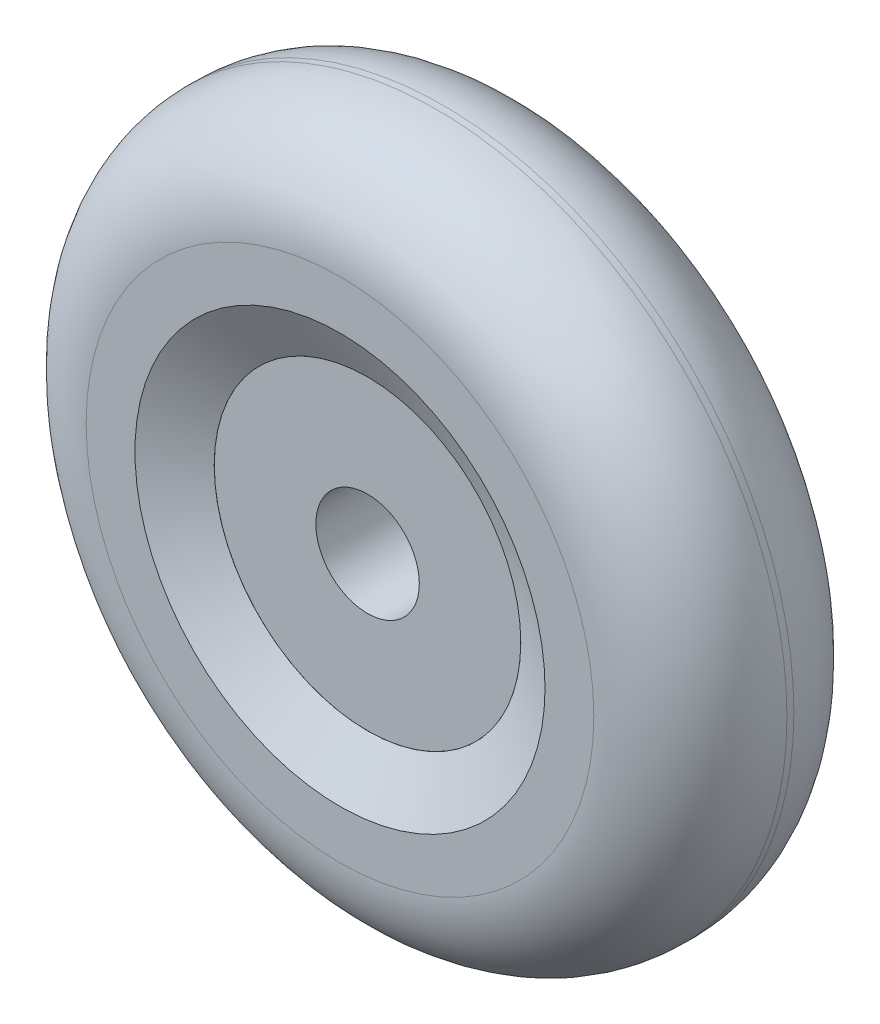
from build123d import *
from build123d.topology import SkipClean

# Parameters (mm, degrees)
CROQUIS1_R                   = 101.6
CROQUIS1_R_2                 = 7.9375
SALIENTE_EXTRUIR1_DEPTH      = 29
REDONDEO1_R                  = 28
CROQUIS2_R                   = 44.45
CORTAR_EXTRUIR1_DEPTH        = 8
CHAFL_N1_SIZE                = 15
CHAFL_N1_SIZE2               = 7.975641475
CHAFL_N2_SIZE                = 7.975641475
CHAFL_N2_SIZE_2              = 15
CORTAR_EXTRUIR2_DEPTH        = 147.581445076
CORTAR_EXTRUIR2_DEPTH_BACK   = 147.581445076
CROQUIS5_R                   = 7.9375
SALIENTE_EXTRUIR2_DEPTH      = 120
CROQUIS6_R                   = 12.9375
CROQUIS6_R_2                 = 7.9375
SALIENTE_EXTRUIR3_DEPTH      = 20
CROQUIS8_R                   = 3
CORTAR_EXTRUIR3_DEPTH        = 20
SALIENTE_EXTRUIR4_DEPTH      = 10
REDONDEO2_R                  = 1
CROQUIS11_R                  = 15
CORTAR_EXTRUIR4_DEPTH        = 50
SALIENTE_EXTRUIR5_DEPTH      = 5
SALIENTE_EXTRUIR5_DEPTH_BACK = 50
CROQUIS12_R                  = 15
CROQUIS12_R_2                = 7.9375
CROQUIS15_R                  = 7.9375
SALIENTE_EXTRUIR7_DEPTH      = 5
CROQUIS13_R                  = 3
SALIENTE_EXTRUIR8_DEPTH      = 5
SALIENTE_EXTRUIR8_2_DEPTH    = 5
SALIENTE_EXTRUIR8_3_DEPTH    = 5
SALIENTE_EXTRUIR8_4_DEPTH    = 5
CROQUIS17_R                  = 3
CORTAR_EXTRUIR5_DEPTH        = 16


with BuildPart() as part:
    # Croquis1 → Saliente-Extruir1 (new, symmetric)
    with BuildSketch(Plane.XY):
        with Locations(Location((0, 0, 0), (0, 0, 180))):
            Circle(CROQUIS1_R)
        with Locations(Location((0, 0, 0), (0, 0, 180))):
            Circle(CROQUIS1_R_2, mode=Mode.SUBTRACT)
    extrude(amount=SALIENTE_EXTRUIR1_DEPTH, both=True)

    # Redondeo1
    redondeo1_edges = [part.edges().sort_by_distance(p)[0] for p in [
        (101.6, 0, -29),
        (101.6, 0, 29),
    ]]
    fillet(redondeo1_edges, radius=REDONDEO1_R)

    # Croquis2 → Cortar-Extruir1 (cut)
    with BuildSketch(Plane(origin=(0, 0, -29), x_dir=(-1, 0, 0), z_dir=(0, 0, -1))):
        Circle(CROQUIS2_R)
    cortar_extruir1 = extrude(amount=-CORTAR_EXTRUIR1_DEPTH, mode=Mode.SUBTRACT)

    # Simetría3: Cortar-Extruir1 across plane
    add(cortar_extruir1.mirror(Plane.XY), mode=Mode.SUBTRACT)

    # Chaflán1
    chafl_n1_edges = [part.edges().sort_by_distance(p)[0] for p in [
        (44.45, 0, -29),
    ]]
    chafl_n1_side = [part.faces().sort_by_distance(p)[0] for p in [
        (71.518277636, 0, -29),
    ]]
    chamfer(chafl_n1_edges, length=CHAFL_N1_SIZE, length2=CHAFL_N1_SIZE2, reference=chafl_n1_side[0])

    # Chaflán2
    # the kernel refuses this chamfer: 15, 7.975641475 mm, written as the material it takes off along each edge
    with BuildSketch(Plane(origin=(0, 0, 29), x_dir=(-1, 0, 0), z_dir=(0, -1, 0))) as chafl_n2_piece_1_section:
        Polygon((44.45 + CHAFL_N2_SIZE, 0), (44.45, CHAFL_N2_SIZE_2), (44.45, 0), align=None)
    chafl_n2_piece_1 = revolve(axis=Axis((0, 0, 29), (0, 0, -1)), mode=Mode.PRIVATE)
    chafl_n2_piece_1 = split(chafl_n2_piece_1, bisect_by=Plane(origin=(50.219175815, 0, 21), z_dir=(0, 0, 1)), keep=Keep.TOP, mode=Mode.PRIVATE)
    add(chafl_n2_piece_1, mode=Mode.SUBTRACT)

    # Croquis3 → Cortar-Extruir2 (cut, two sides: drawn at the far end of the back side and taken through both)
    with BuildSketch(Plane(origin=(0, 0, 0), x_dir=(0, 0, -1), z_dir=(1, 0, 0)).offset(-CORTAR_EXTRUIR2_DEPTH_BACK)):
        Polygon((0, -580.951086966), (0, -121.331484358), (0, 121.331484358), (0, 580.951086966), (-919.239205217, 580.951086966), (-919.239205217, -580.951086966), align=None)
    extrude(amount=CORTAR_EXTRUIR2_DEPTH + CORTAR_EXTRUIR2_DEPTH_BACK, mode=Mode.SUBTRACT)

    # Simetría4: part across plane


with BuildPart() as part_1:
    add(part.part)
    add(part.part.mirror(Plane(origin=(376.375487344, -121.331484358, 0), x_dir=(1, 0, 0), z_dir=(0, 0, 1))))

    # Croquis11 → Cortar-Extruir4 (cut)
    with BuildSketch(Plane.XY.offset(21)):
        Circle(CROQUIS11_R)
    extrude(amount=-CORTAR_EXTRUIR4_DEPTH, mode=Mode.SUBTRACT)


with BuildPart() as body_2:
    # Croquis5 → Saliente-Extruir2 (new body)
    with BuildSketch(Plane.XY.offset(21)):
        with Locations(Location((0, 0, 0), (0, 0, 180))):
            Circle(CROQUIS5_R)
    extrude(amount=-SALIENTE_EXTRUIR2_DEPTH)


with BuildPart() as body_3:
    # Croquis6 → Saliente-Extruir3 (new body)
    with BuildSketch(Plane(origin=(0, 0, -99), x_dir=(-1, 0, 0), z_dir=(0, 0, -1))):
        Circle(CROQUIS6_R)
        Circle(CROQUIS6_R_2, mode=Mode.SUBTRACT)
    extrude(amount=-SALIENTE_EXTRUIR3_DEPTH)

    # Croquis8 → Cortar-Extruir3 (cut)
    with BuildSketch(Plane(origin=(0, 0, 0), x_dir=(1, 0, 0), z_dir=(0, 1, 0))):
        with Locations(Location((0, 89, 0), (0, 0, 90))):
            Circle(CROQUIS8_R)
    extrude(amount=CORTAR_EXTRUIR3_DEPTH, mode=Mode.SUBTRACT)

    # Croquis10 → Saliente-Extruir4 (add)
    with BuildSketch(Plane(origin=(0, 0, -99), x_dir=(-1, 0, 0), z_dir=(0, 0, -1))):
        with BuildLine():
            Line((-5, 17.5), (5, 17.5))
            ThreePointArc((5, 17.5), (7.856559563, 13.607960336), (12.655444566, 13.080127019))
            Line((12.655444566, 13.080127019), (17.655444566, 4.419872981))
            ThreePointArc((17.655444566, 4.419872981), (15.713119126, 0), (17.655444566, -4.419872981))
            Line((17.655444566, -4.419872981), (12.655444566, -13.080127019))
            ThreePointArc((12.655444566, -13.080127019), (7.856559563, -13.607960336), (5, -17.5))
            Line((5, -17.5), (-5, -17.5))
            ThreePointArc((-5, -17.5), (-7.856559563, -13.607960336), (-12.655444566, -13.080127019))
            Line((-12.655444566, -13.080127019), (-17.655444566, -4.419872981))
            ThreePointArc((-17.655444566, -4.419872981), (-15.713119126, 0), (-17.655444566, 4.419872981))
            Line((-17.655444566, 4.419872981), (-12.655444566, 13.080127019))
            ThreePointArc((-12.655444566, 13.080127019), (-7.856559563, 13.607960336), (-5, 17.5))
        make_face()
    extrude(amount=SALIENTE_EXTRUIR4_DEPTH)

    # Redondeo2
    redondeo2_edges = [body_3.edges().sort_by_distance(p)[0] for p in [
        (5, 17.5, -104),
        (12.655444566, 13.080127019, -104),
        (17.655444566, 4.419872981, -104),
        (17.655444566, -4.419872981, -104),
        (12.655444566, -13.080127019, -104),
        (5, -17.5, -104),
        (-5, -17.5, -104),
        (-12.655444566, -13.080127019, -104),
        (-17.655444566, -4.419872981, -104),
        (-17.655444566, 4.419872981, -104),
        (-12.655444566, 13.080127019, -104),
        (-5, 17.5, -104),
    ]]
    fillet(redondeo2_edges, radius=REDONDEO2_R)


with BuildPart() as body_4:
    # Croquis12 → Saliente-Extruir5 (new, two sides: drawn at the far end of the back side and taken through both)
    with BuildSketch(Plane.XY.offset(21).offset(-SALIENTE_EXTRUIR5_DEPTH_BACK)):
        Circle(CROQUIS12_R)
        with Locations(Location((0, 0, 0), (0, 0, 180))):
            Circle(CROQUIS12_R_2, mode=Mode.SUBTRACT)
    extrude(amount=SALIENTE_EXTRUIR5_DEPTH + SALIENTE_EXTRUIR5_DEPTH_BACK)


with BuildPart() as body_5:
    # Croquis15 → Saliente-Extruir7 (new body)
    with BuildSketch(Plane.XY.offset(21)):
        with Locations(Location((0, 0, 0), (0, 0, 180))):
            Circle(CROQUIS15_R)
    extrude(amount=SALIENTE_EXTRUIR7_DEPTH)

    # Combinar1: union body 2
    add(body_2.part)


with BuildPart() as body_5_2:
    # Croquis13 → Saliente-Extruir8 (new body)
    with BuildSketch(Plane.XY.offset(26)):
        with BuildLine():
            Line((5, -25), (5, -6.164730834))
            ThreePointArc((5, -6.164730834), (0, -7.9375), (-5, -6.164730834))
            Line((-5, -6.164730834), (-5, -25))
            Line((-5, -25), (5, -25))
        make_face()
        with Locations((0, -18.5)):
            Circle(CROQUIS13_R, mode=Mode.SUBTRACT)
    extrude(amount=-SALIENTE_EXTRUIR8_DEPTH)


with BuildPart() as body_6:
    # Croquis13 → Saliente-Extruir8 2 (new body)
    with BuildSketch(Plane.XY.offset(26)):
        with BuildLine():
            Line((-5, 25), (5, 25))
            Line((5, 25), (5, 6.164730834))
            ThreePointArc((5, 6.164730834), (0, 7.9375), (-5, 6.164730834))
            Line((-5, 6.164730834), (-5, 25))
        make_face()
        with Locations((0, 18.5)):
            Circle(CROQUIS13_R, mode=Mode.SUBTRACT)
    extrude(amount=-SALIENTE_EXTRUIR8_2_DEPTH)


with BuildPart() as body_7:
    # Croquis13 → Saliente-Extruir8 3 (new body)
    with BuildSketch(Plane.XY.offset(26)):
        with BuildLine():
            Line((-25, -5), (-6.164730834, -5))
            ThreePointArc((-6.164730834, -5), (-7.9375, 0), (-6.164730834, 5))
            Line((-6.164730834, 5), (-25, 5))
            Line((-25, 5), (-25, 0))
            Line((-25, 0), (-25, -5))
        make_face()
        with Locations((-18.5, 0)):
            Circle(CROQUIS13_R, mode=Mode.SUBTRACT)
    extrude(amount=-SALIENTE_EXTRUIR8_3_DEPTH)


with BuildPart() as body_8:
    # Croquis13 → Saliente-Extruir8 4 (new body)
    with BuildSketch(Plane.XY.offset(26)):
        with BuildLine():
            Line((25, -5), (25, 5))
            Line((25, 5), (6.164730834, 5))
            ThreePointArc((6.164730834, 5), (7.9375, 0), (6.164730834, -5))
            Line((6.164730834, -5), (25, -5))
        make_face()
        with Locations((18.5, 0)):
            Circle(CROQUIS13_R, mode=Mode.SUBTRACT)
    extrude(amount=-SALIENTE_EXTRUIR8_4_DEPTH)


with BuildPart() as body_4_1:
    add(body_4.part)

    # Combinar2: union body 6, body 8, body 5 2, body 7
    add(body_6.part)
    add(body_8.part)
    add(body_5_2.part)
    add(body_7.part)

    # Croquis17 → Cortar-Extruir5 (cut)
    with SkipClean():  # the faces are left unmerged after this step: merging them gives an invalid solid
        with BuildSketch(Plane(origin=(0, 0, 0), x_dir=(1, 0, 0), z_dir=(0, 1, 0))):
            with Locations(Location((0, 24, 0), (0, 0, 90))):
                Circle(CROQUIS17_R)
        extrude(amount=CORTAR_EXTRUIR5_DEPTH, mode=Mode.SUBTRACT)


solid = part_1.part
